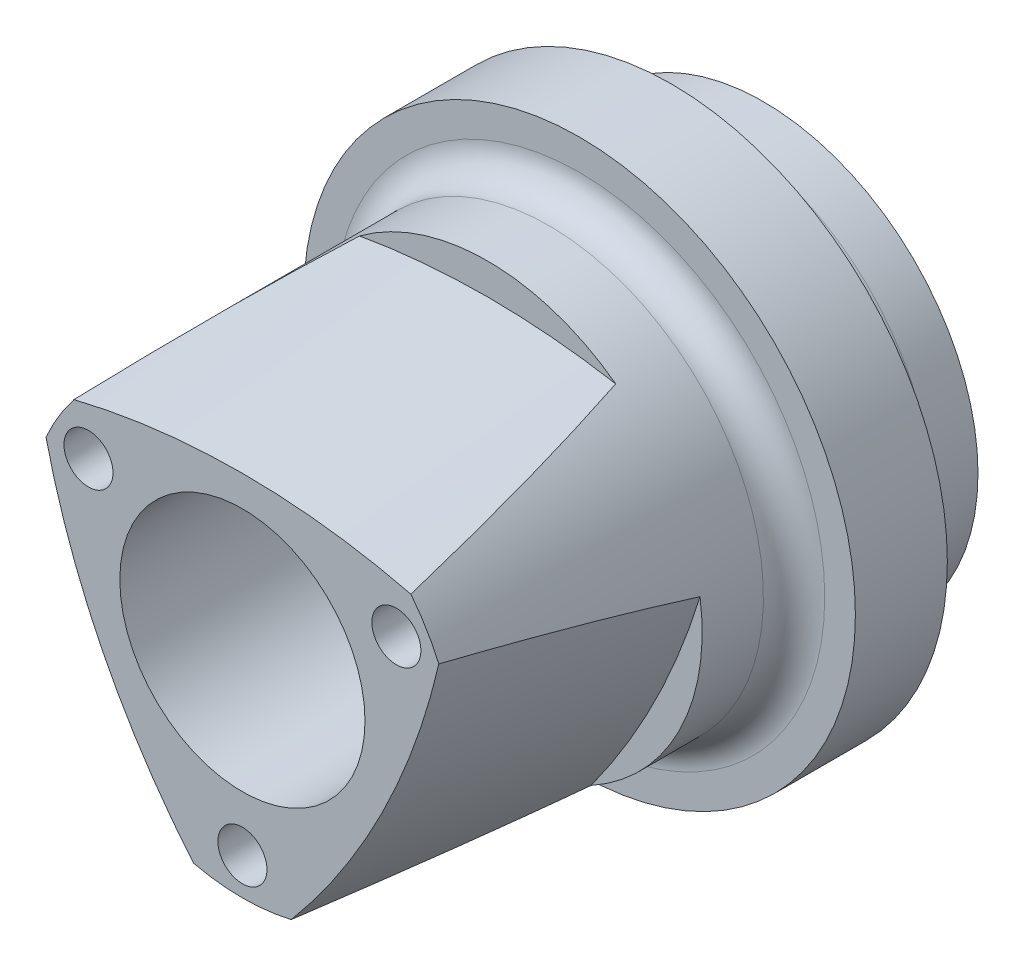
from build123d import *

# Parameters (mm, degrees)
FILLET1_R            = 7.5
FILLET2_R            = 5
CUT_EXTRUDE4_DEPTH   = 40
CUT_EXTRUDE4_DRAFT   = -7
CUT_EXTRUDE4_2_DEPTH = 40
CUT_EXTRUDE4_2_DRAFT = -7
CUT_EXTRUDE4_3_DEPTH = 40
CUT_EXTRUDE4_3_DRAFT = -7
SKETCH4_R            = 4
CUT_EXTRUDE5_DEPTH   = 107.183802908


# Read off the part's stored shape, not the designer's step: Cut-Extrude4
with BuildPart() as part:
    # Sketch1 → Revolve1 (revolve)
    with BuildSketch(Plane(origin=(0, 0, 0), x_dir=(0, 0, -1), z_dir=(1, 0, 0)), mode=Mode.PRIVATE) as revolve1_sk:
        Polygon((0, 20), (-85, 20), (-85, 35), (-30, 35), (-30, 45), (-15, 45), (-15, 35), (0, 35), align=None)
    revolve(revolve1_sk.sketch.rotate(Axis((0, 0, 95.688392975), (0, 0, -1)), 90), axis=Axis((0, 0, 95.688392975), (0, 0, -1)))

    # Fillet1
    fillet1_edges = [part.edges().sort_by_distance(p)[0] for p in [
        (-35, 0, 15),
    ]]
    fillet(fillet1_edges, radius=FILLET1_R)

    # Fillet2
    fillet2_edges = [part.edges().sort_by_distance(p)[0] for p in [
        (-35, 0, 30),
    ]]
    fillet(fillet2_edges, radius=FILLET2_R)


with BuildPart() as cut_extrude4_tool:
    # Cut-Extrude4 outline → Cut-Extrude4 (with draft: the straight prism first)
    with BuildSketch(Plane.XY.offset(45)):
        with BuildLine():
            ThreePointArc((16.880866709, -30.660012054), (31.304951685, -15.652475842), (34.656529669, 4.891313865))
            ThreePointArc((34.656529669, 4.891313865), (27.252000961, -13.626000481), (16.880866709, -30.660012054))
        make_face()
    extrude(amount=CUT_EXTRUDE4_DEPTH)
    # Cut-Extrude4: the draft: its side faces are tilted about the plane it starts from
    cut_extrude4_sides = [cut_extrude4_tool.faces().sort_by_distance(p)[0] for p in [
        (27.252000961, -13.626000481, 65),
        (31.304951685, -15.652475842, 65),
    ]]
    draft(cut_extrude4_sides, Plane.XY.offset(45), CUT_EXTRUDE4_DRAFT)


with BuildPart() as part_1:
    add(part.part)

    # Cut-Extrude4: cut by cut_extrude4_tool
    add(cut_extrude4_tool.part, mode=Mode.SUBTRACT)


with BuildPart() as cut_extrude4_2_tool:
    # Cut-Extrude4 2 outline → Cut-Extrude4 2 (with draft: the straight prism first)
    with BuildSketch(Plane.XY.offset(45)):
        with BuildLine():
            ThreePointArc((-34.656529669, 4.891313865), (-31.304951685, -15.652475842), (-16.880866709, -30.660012054))
            ThreePointArc((-16.880866709, -30.660012054), (-27.252000961, -13.626000481), (-34.656529669, 4.891313865))
        make_face()
    extrude(amount=CUT_EXTRUDE4_2_DEPTH)
    # Cut-Extrude4 2: the draft: its side faces are tilted about the plane it starts from
    cut_extrude4_2_sides = [cut_extrude4_2_tool.faces().sort_by_distance(p)[0] for p in [
        (-31.304951685, -15.652475842, 65),
        (-27.252000961, -13.626000481, 65),
    ]]
    draft(cut_extrude4_2_sides, Plane.XY.offset(45), CUT_EXTRUDE4_2_DRAFT)


with BuildPart() as part_2:
    add(part_1.part)

    # Cut-Extrude4 2: cut by cut_extrude4_2_tool
    add(cut_extrude4_2_tool.part, mode=Mode.SUBTRACT)


with BuildPart() as cut_extrude4_3_tool:
    # Cut-Extrude4 3 outline → Cut-Extrude4 3 (with draft: the straight prism first)
    with BuildSketch(Plane.XY.offset(45)):
        with BuildLine():
            ThreePointArc((20.897837677, 28.076331321), (0, 35), (-20.897837677, 28.076331321))
            ThreePointArc((-20.897837677, 28.076331321), (0, 29.911382436), (20.897837677, 28.076331321))
        make_face()
    extrude(amount=CUT_EXTRUDE4_3_DEPTH)
    # Cut-Extrude4 3: the draft: its side faces are tilted about the plane it starts from
    cut_extrude4_3_sides = [cut_extrude4_3_tool.faces().sort_by_distance(p)[0] for p in [
        (0, 35, 65),
        (0, 29.911382436, 65),
    ]]
    draft(cut_extrude4_3_sides, Plane.XY.offset(45), CUT_EXTRUDE4_3_DRAFT)


with BuildPart() as part_3:
    add(part_2.part)

    # Cut-Extrude4 3: cut by cut_extrude4_3_tool
    add(cut_extrude4_3_tool.part, mode=Mode.SUBTRACT)

    # Sketch4 → Cut-Extrude5 (cut, through all)
    with BuildSketch(Plane.XY.offset(85)):
        with Locations((25.11473671, 14.5)):
            Circle(SKETCH4_R)
        with Locations((-25.11473671, 14.5)):
            Circle(SKETCH4_R)
        with Locations((0, -29)):
            Circle(SKETCH4_R)
    extrude(amount=-CUT_EXTRUDE5_DEPTH, mode=Mode.SUBTRACT)


solid = part_3.part
